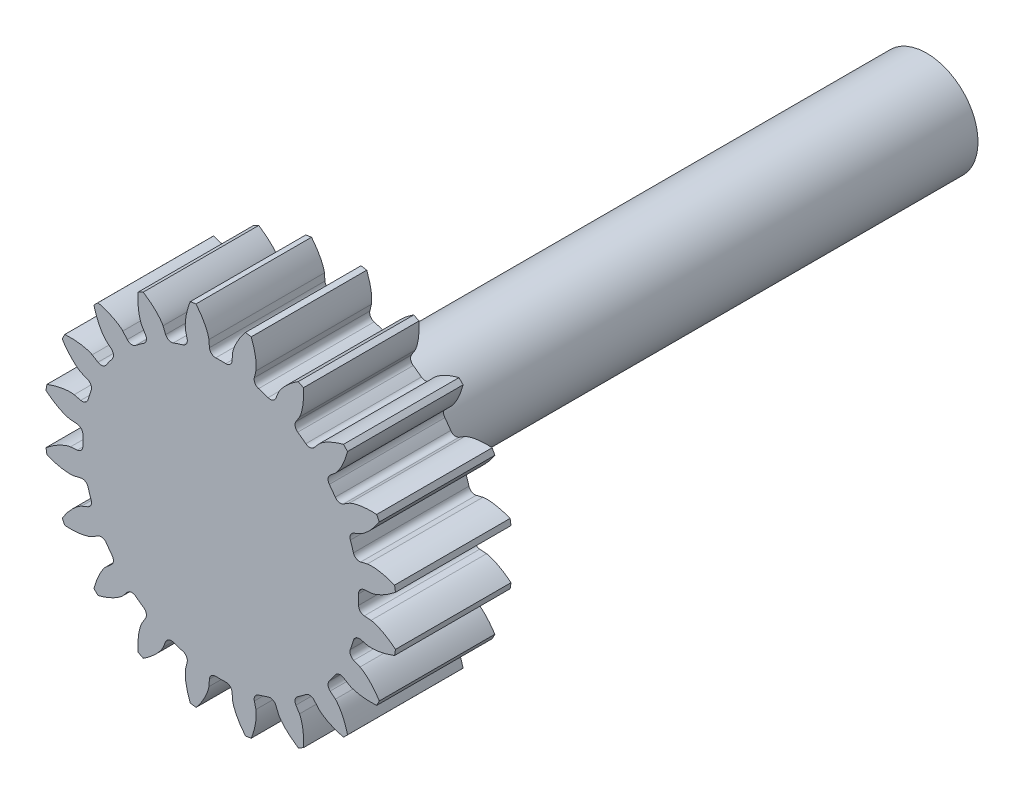
from build123d import *

# Parameters (mm, degrees)
BLANK_SKETCH_R      = 13.75
BLANK_DEPTH         = 9
TOOTH_SPACE_DEPTH   = 22.427202337
TEETH_COUNT         = 20
BORE_DEPTH          = 22.253469727
BORE_DEPTH_BACK     = 22.253469727
BORE_SKETCH_R       = 4
BOSS_EXTRUDE1_START = -55
SKETCH1_R           = 4
BOSS_EXTRUDE1_DEPTH = 55


with BuildPart() as part:
    # Blank Sketch → Blank (new body)
    with BuildSketch(Plane.XY):
        Circle(BLANK_SKETCH_R)
    extrude(amount=BLANK_DEPTH)

    # Tooth Space Sketch → Tooth Space (cut, symmetric)
    with BuildSketch(Plane.XY):
        with BuildLine():
            Line((11.709860103, 0.922712572), (11.180289267, 0.880983494))
            ThreePointArc((11.180289267, 0.880983494), (10.862988941, 0.723480031), (10.742915644, 0.39020951))
            ThreePointArc((10.742915644, 0.39020951), (10.75, 0), (10.742915644, -0.39020951))
            ThreePointArc((10.742915644, -0.39020951), (10.862988941, -0.723480031), (11.180289267, -0.880983494))
            Line((11.180289267, -0.880983494), (11.709860103, -0.922712572))
            add(Edge.make_bspline(
                [(11.709860103, -0.922712572), (11.715313475, -0.923234617), (11.730580069, -0.924982426), (11.759319753, -0.929405731), (11.80598663, -0.938205714), (11.86506971, -0.951736167), (11.94092317, -0.971871237), (12.029548412, -0.998976801), (12.126085986, -1.032288866), (12.230093072, -1.072304199), (12.332879138, -1.115538905), (12.434437251, -1.161726096), (12.534681177, -1.210479105), (12.654945734, -1.272744636), (12.797491556, -1.351852601), (12.961497116, -1.450701421), (13.144282968, -1.570278326), (13.326873882, -1.699980424), (13.503420438, -1.834000155), (13.677968733, -1.976594979), (13.844122091, -2.119647646), (14.012499078, -2.275384766), (14.16579995, -2.422795632), (14.332640843, -2.595647481), (14.46587003, -2.737409714), (14.599233693, -2.890118061), (14.663505795, -2.96535919), (14.69608147, -3.004195304)],
                knots=[0, 0, 0, 0, 0, 0.005376749, 0.015083688, 0.02853182, 0.046610139, 0.064854849, 0.092110525, 0.119476176, 0.146842496, 0.174208854, 0.201574956, 0.228941013, 0.256307345, 0.307035032, 0.361767352, 0.41649966, 0.471231936, 0.525964282, 0.580696615, 0.635428982, 0.690161387, 0.744893688, 0.799626082, 0.854358408, 0.909090915, 0.909090915, 0.909090915, 0.909090915, 0.909090915], degree=4))
            Line((14.69608147, -3.004195304), (14.69608147, 3.004195304))
            add(Edge.make_bspline(
                [(11.709860103, 0.922712572), (11.715313475, 0.923234617), (11.730580069, 0.924982426), (11.759319753, 0.929405731), (11.80598663, 0.938205714), (11.86506971, 0.951736167), (11.94092317, 0.971871237), (12.029548412, 0.998976801), (12.126085986, 1.032288866), (12.230093072, 1.072304199), (12.332879138, 1.115538905), (12.434437251, 1.161726096), (12.534681177, 1.210479105), (12.654945734, 1.272744636), (12.797491556, 1.351852601), (12.961497116, 1.450701421), (13.144282968, 1.570278326), (13.326873882, 1.699980424), (13.503420438, 1.834000155), (13.677968733, 1.976594979), (13.844122091, 2.119647646), (14.012499078, 2.275384766), (14.16579995, 2.422795632), (14.332640843, 2.595647481), (14.46587003, 2.737409714), (14.599233693, 2.890118061), (14.663505795, 2.96535919), (14.69608147, 3.004195304)],
                knots=[0, 0, 0, 0, 0, 0.005376749, 0.015083688, 0.02853182, 0.046610139, 0.064854849, 0.092110525, 0.119476176, 0.146842496, 0.174208854, 0.201574956, 0.228941013, 0.256307345, 0.307035032, 0.361767352, 0.41649966, 0.471231936, 0.525964282, 0.580696615, 0.635428982, 0.690161387, 0.744893688, 0.799626082, 0.854358408, 0.909090915, 0.909090915, 0.909090915, 0.909090915, 0.909090915], degree=4))
        make_face()
    tooth_space = extrude(amount=TOOTH_SPACE_DEPTH, both=True, mode=Mode.SUBTRACT)

    # Teeth: Tooth Space ×20 about axis
    teeth_axis = Axis((0, 0, -0.45007105), (0, 0, 1))
    for i in range(1, TEETH_COUNT):
        add(tooth_space.rotate(teeth_axis, i * 360 / TEETH_COUNT), mode=Mode.SUBTRACT)

    # Bore Sketch → Bore (cut, two sides: drawn at the far end of the back side and taken through both)
    with BuildSketch(Plane.XY.offset(-BORE_DEPTH_BACK)):
        Circle(BORE_SKETCH_R)
    extrude(amount=BORE_DEPTH + BORE_DEPTH_BACK, mode=Mode.SUBTRACT)

    # Sketch1 → Boss-Extrude1 (add)
    with BuildSketch(Plane.XY.offset(9).offset(BOSS_EXTRUDE1_START)):
        Circle(SKETCH1_R)
    extrude(amount=BOSS_EXTRUDE1_DEPTH)


solid = part.part
